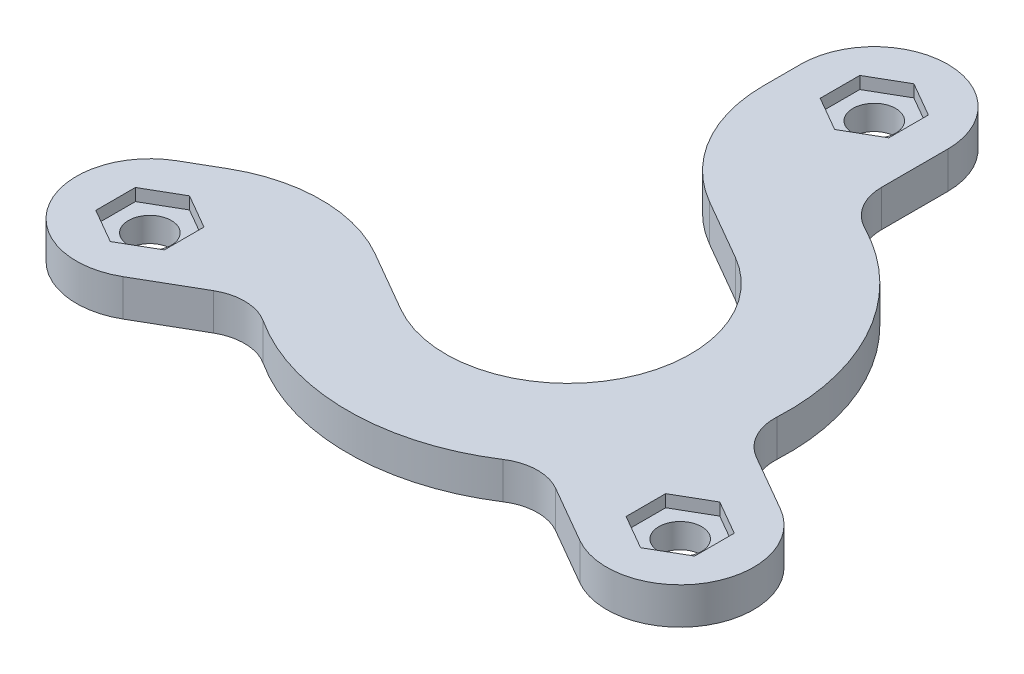
from build123d import *

# Parameters (mm, degrees)
SKETCH1_R           = 1.75
BOSS_EXTRUDE1_DEPTH = 3
CUT_EXTRUDE1_DEPTH  = 1


with BuildPart() as part:
    # Sketch1 → Boss-Extrude1 (new body)
    with BuildSketch(Plane(origin=(0, 0, 0), x_dir=(1, 0, 0), z_dir=(0, 1, 0))):
        with BuildLine():
            Line((24.650635095, -7.303847577), (19.970562748, -4.601806548))
            ThreePointArc((19.970562748, -4.601806548), (18.45588895, -3.047434781), (17.975914976, -0.930849491))
            ThreePointArc((17.975914976, -0.930849491), (15.588457268, 9), (8.181818182, 16.033023771))
            ThreePointArc((8.181818182, 16.033023771), (6.588788538, 17.506986071), (6, 19.595917942))
            Line((6, 19.595917942), (6, 25))
            ThreePointArc((6, 25), (0, 31), (-6, 25))
            Line((-6, 25), (-6, 21.939310229))
            ThreePointArc((-6, 21.939310229), (-4.392304845, 15.939310229), (0, 11.547005384))
            Line((0, 11.547005384), (5, 8.660254038))
            ThreePointArc((5, 8.660254038), (8.660254038, -5), (-5, -8.660254038))
            Line((-5, -8.660254038), (-10, -5.773502692))
            ThreePointArc((-10, -5.773502692), (-16, -4.165807537), (-22, -5.773502692))
            Line((-22, -5.773502692), (-24.650635095, -7.303847577))
            ThreePointArc((-24.650635095, -7.303847577), (-26.846787517, -15.5), (-18.650635095, -17.696152423))
            Line((-18.650635095, -17.696152423), (-13.970562748, -14.994111394))
            ThreePointArc((-13.970562748, -14.994111394), (-11.867100412, -14.45955129), (-9.794096794, -15.10217428))
            ThreePointArc((-9.794096794, -15.10217428), (0, -18), (9.794096794, -15.10217428))
            ThreePointArc((9.794096794, -15.10217428), (11.867100412, -14.45955129), (13.970562748, -14.994111394))
            Line((13.970562748, -14.994111394), (18.650635095, -17.696152423))
            ThreePointArc((18.650635095, -17.696152423), (26.846787517, -15.5), (24.650635095, -7.303847577))
        make_face()
        with Locations((0, 25)):
            Circle(SKETCH1_R, mode=Mode.SUBTRACT)
        with Locations((21.650635095, -12.5)):
            Circle(SKETCH1_R, mode=Mode.SUBTRACT)
        with Locations((-21.650635095, -12.5)):
            Circle(SKETCH1_R, mode=Mode.SUBTRACT)
    extrude(amount=BOSS_EXTRUDE1_DEPTH)

    # Sketch2 → Cut-Extrude1 (cut)
    with BuildSketch(Plane(origin=(0, 3, 0), x_dir=(1, 0, 0), z_dir=(0, 1, 0))):
        Polygon((2.8, 23.383419246), (2.8, 26.616580754), (0, 28.233161507), (-2.8, 26.616580754), (-2.8, 23.383419246), (0, 21.766838493), align=None)
        Polygon((24.450635095, -14.116580754), (24.450635095, -10.883419246), (21.650635095, -9.266838493), (18.850635095, -10.883419246), (18.850635095, -14.116580754), (21.650635095, -15.733161507), align=None)
        Polygon((-24.450635095, -14.116580754), (-21.650635095, -15.733161507), (-18.850635095, -14.116580754), (-18.850635095, -10.883419246), (-21.650635095, -9.266838493), (-24.450635095, -10.883419246), align=None)
    extrude(amount=-CUT_EXTRUDE1_DEPTH, mode=Mode.SUBTRACT)


solid = part.part
